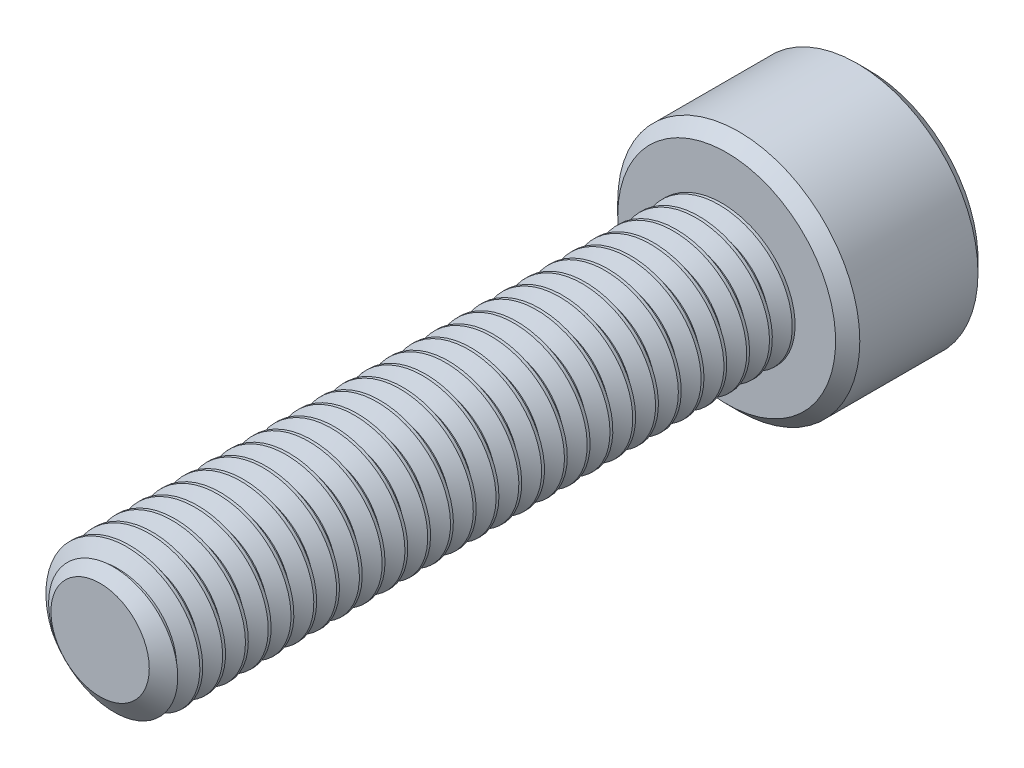
from build123d import *

# Parameters (mm, degrees)
SKETCH1_R          = 2.5
EXTRUDE1_DEPTH     = 22
CUT_SWEEP1_PITCH   = 0.8
SKETCH6_R          = 4.25
EXTRUDE2_DEPTH     = 5
CUT_EXTRUDE1_DEPTH = 3
CHAMFER1_SIZE      = 0.425


with BuildPart() as part:
    # Sketch1 → Extrude1 (new body)
    with BuildSketch(Plane.XY):
        Circle(SKETCH1_R)
    extrude(amount=-EXTRUDE1_DEPTH)

    # Cut-Sweep1: arcs per turn and ends read off the stored shape
    # Cut-Sweep1: the profile of Sketch3 profile screwed along a right-hand helix through 30 turns, 6 arcs to a turn; built about Z, then put on its axis
    cut_sweep1_z = Axis((0, 0, 0), (0, 0, 1))
    cut_sweep1_corners = [(2.5003, 0, -1.500173205), (1.980384758, 0, -1.2), (1.980384758, 0, -1.1), (2.5003, 0, -0.799826795)]
    with BuildLine(mode=Mode.PRIVATE) as cut_sweep1_profile:
        Line(cut_sweep1_corners[0], cut_sweep1_corners[1])
        Line(cut_sweep1_corners[1], cut_sweep1_corners[2])
        Line(cut_sweep1_corners[2], cut_sweep1_corners[3])
        Line(cut_sweep1_corners[3], cut_sweep1_corners[0])
    cut_sweep1_cap = Face(cut_sweep1_profile.wire())
    cut_sweep1_turn_angles = [0, 30, 60, 90, 120, 150, 180, 210, 240, 270, 300, 330, 360]
    cut_sweep1_turn_weights = [1, 0.8660254037844387, 1, 0.8660254037844387, 1, 0.8660254037844387, 1, 0.8660254037844387, 1, 0.8660254037844387, 1, 0.8660254037844387, 1]
    cut_sweep1_turn_rails = [Edge.make_bspline([Vector(p[0], p[1], 0).rotate(cut_sweep1_z, cut_sweep1_turn_angles[k]) / cut_sweep1_turn_weights[k] + Vector(0, 0, p[2] + CUT_SWEEP1_PITCH * cut_sweep1_turn_angles[k] / 360) for k in range(13)], [0, 0, 0, 1, 1, 2, 2, 3, 3, 4, 4, 5, 5, 6, 6, 6], 2, cut_sweep1_turn_weights) for p in cut_sweep1_corners]
    cut_sweep1_turn_sides = [Face.make_surface_from_curves(cut_sweep1_turn_rails[p[0]], cut_sweep1_turn_rails[p[1]]) for p in [(0, 1), (1, 2), (2, 3), (3, 0)]]
    cut_sweep1 = Plane(origin=(0, 0, 0), x_dir=(0, 1, 0), z_dir=(0, 0, -1)) * Solid(Shell([*[p.moved(Location((0, 0, CUT_SWEEP1_PITCH * i))) for i in range(30) for p in cut_sweep1_turn_sides], cut_sweep1_cap, cut_sweep1_cap.rotate(cut_sweep1_z, 10800).moved(Location((0, 0, CUT_SWEEP1_PITCH * 10800 / 360)))]))
    add(cut_sweep1, mode=Mode.SUBTRACT)

    # Sketch4 → Cut-Revolve1 (revolve, cut)
    with BuildSketch(Plane(origin=(0, 0, 0), x_dir=(0, 0, -1), z_dir=(1, 0, 0)), mode=Mode.PRIVATE) as cut_revolve1_sk:
        Polygon((0.541691224, 2.5), (0, 1.726384758), (0, 2.5), align=None)
    revolve(cut_revolve1_sk.sketch.rotate(Axis((0, 0, 0), (0, 0, -1)), 260.43858876), axis=Axis((0, 0, 0), (0, 0, -1)), mode=Mode.SUBTRACT)

    # Sketch6 → Extrude2 (add)
    with BuildSketch(Plane(origin=(0, 0, -22), x_dir=(-1, 0, 0), z_dir=(0, 0, -1))):
        Circle(SKETCH6_R)
    extrude(amount=EXTRUDE2_DEPTH)

    # Sketch7 → Cut-Extrude1 (cut)
    with BuildSketch(Plane(origin=(0, 0, -27), x_dir=(-1, 0, 0), z_dir=(0, 0, -1))):
        Polygon((0, 2.309401077), (-2, 1.154700538), (-2, -1.154700538), (0, -2.309401077), (2, -1.154700538), (2, 1.154700538), align=None)
    extrude(amount=-CUT_EXTRUDE1_DEPTH, mode=Mode.SUBTRACT)

    # Cut-Extrude2 cone 1 section (through the dimple's axis) → Cut-Extrude2 (revolve, cut)
    with BuildSketch(Plane(origin=(0, 0, -27), x_dir=(0, 1, 0), z_dir=(1, 0, 0))):
        Polygon((0, 0), (2.309401077, 0), (0, 2.309401077), align=None)
    revolve(axis=Axis((0, 0, -27), (0, 0, 1)), mode=Mode.SUBTRACT)

    # Chamfer1
    chamfer1_edges = [part.edges().sort_by_distance(p)[0] for p in [
        (4.25, 0, -22),
        (4.25, 0, -27),
    ]]
    chamfer(chamfer1_edges, length=CHAMFER1_SIZE)


solid = part.part
